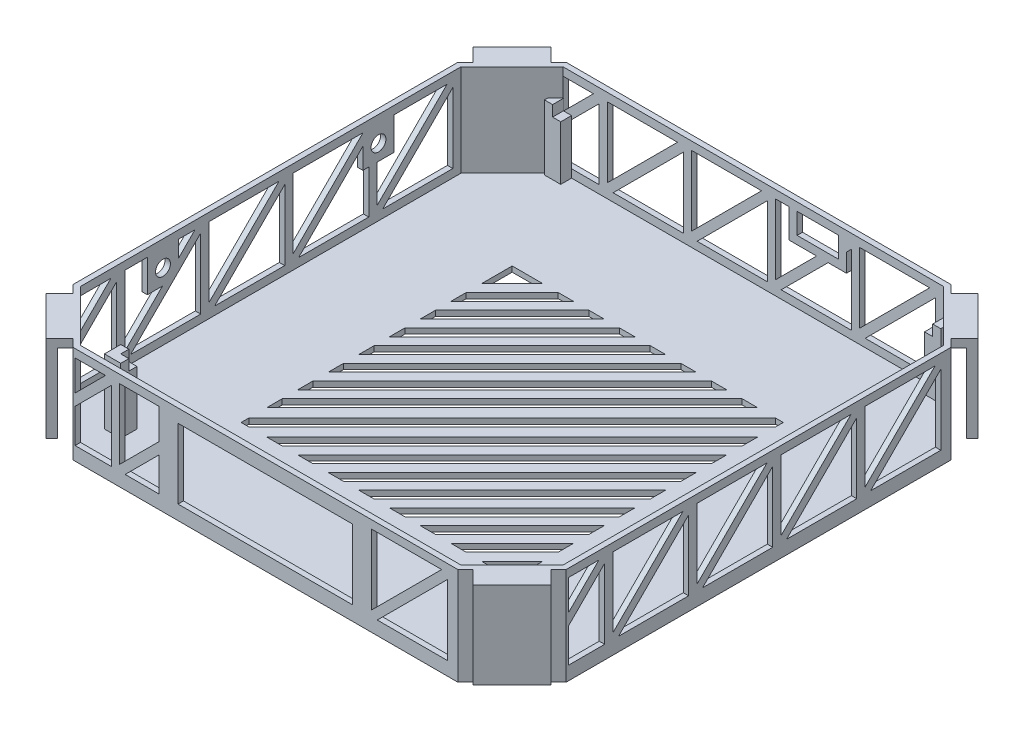
from build123d import *

# Parameters (mm, degrees)
SKETCH1_W              = 20
SKETCH1_H              = 55
SKETCH1_H_2            = 40
SKETCH1_R              = 4.251058991
SKETCH1_H_3            = 7.5
BOSS_EXTRUDE1_DEPTH    = 18
SHELL1_T               = -1
CUT_EXTRUDE1_REACH     = 104.89
BOSS_EXTRUDE3_DEPTH    = 5.07
MIRROR3_COPY_1_DEPTH   = 5.07
CUT_EXTRUDE2_REACH     = 105.845
SKETCH5_R              = 1.375
BOSS_EXTRUDE9_DEPTH    = 12
SKETCH6_6_W            = 1.5
SKETCH6_6_H            = 2
SKETCH6_6_H_2          = 1.5
BOSS_EXTRUDE10_DEPTH   = 10
CUT_EXTRUDE3_REACH     = 105.845
SKETCH7_W              = 32.2
SKETCH7_H              = 12.9
CUT_EXTRUDE7_REACH     = 105.845
BOSS_EXTRUDE12_START   = -45.5
BOSS_EXTRUDE12_DEPTH   = 1
CUT_EXTRUDE8_START     = 12.66
CUT_EXTRUDE8_OUTLINE_W = 3.685786438
CUT_EXTRUDE8_OUTLINE_H = 2.5
CUT_EXTRUDE8_DEPTH     = 2.500660172
CUT_EXTRUDE9_REACH     = 105.845
CUT_EXTRUDE10_REACH    = 70.005
CUT_EXTRUDE11_REACH    = 70.005
LPATTERN1_DEPTH        = 1


# Read off the part's stored shape, not the designer's step: Boss-Extrude12, Cut-Extrude8, LPattern1
with BuildPart() as part:
    # Sketch1 → Boss-Extrude1 (new body)
    # profile 1 of 5: a face of its own
    with BuildSketch(Plane(origin=(0, 0, 0), x_dir=(1, 0, 0), z_dir=(0, 1, 0))):
        Polygon((-45.5, 35.5), (-45.5, -35.5), (-35.5, -45.5), (35.5, -45.5), (45.5, -35.5), (45.5, 35.5), (35.5, 45.5), (-35.5, 45.5), align=None)
        with Locations((0, -10.9)):
            Rectangle(SKETCH1_W, SKETCH1_H, mode=Mode.SUBTRACT)
    # profile 2 of 5: a face of its own
    with BuildSketch(Plane(origin=(0, 0, 0), x_dir=(1, 0, 0), z_dir=(0, 1, 0))):
        with Locations((0, -10.9)):
            Rectangle(SKETCH1_W, SKETCH1_H_2)
        Circle(SKETCH1_R, mode=Mode.SUBTRACT)
    # profile 3 of 5: a face of its own
    with BuildSketch(Plane(origin=(0, 0, 0), x_dir=(1, 0, 0), z_dir=(0, 1, 0))):
        with Locations((0, 12.85)):
            Rectangle(SKETCH1_W, SKETCH1_H_3)
    # profile 4 of 5: a face of its own
    with BuildSketch(Plane(origin=(0, 0, 0), x_dir=(1, 0, 0), z_dir=(0, 1, 0))):
        with Locations((0, -34.65)):
            Rectangle(SKETCH1_W, SKETCH1_H_3)
    # profile 5 of 5: a face of its own
    with BuildSketch(Plane(origin=(0, 0, 0), x_dir=(1, 0, 0), z_dir=(0, 1, 0))):
        Circle(SKETCH1_R)
    extrude(amount=BOSS_EXTRUDE1_DEPTH)

    # Shell1
    shell1_openings = [part.faces().sort_by_distance(p)[0] for p in [
        (0, 18, 0),
    ]]
    offset(amount=SHELL1_T, openings=shell1_openings, kind=Kind.INTERSECTION)

    # Sketch2 → Cut-Extrude1 (cut, up to next)
    with BuildSketch(Plane(origin=(44.5, 0, 1), x_dir=(0, 0, -1), z_dir=(1, 0, 0)), mode=Mode.PRIVATE) as cut_extrude1_sk1:
        Polygon((34.585786438, 15.439339828), (21.646446609, 2.5), (34.585786438, 2.5), align=None)
    cut_extrude1_tool1 = extrude(cut_extrude1_sk1.sketch, amount=CUT_EXTRUDE1_REACH, mode=Mode.PRIVATE) & part.part
    # Sketch2 → Cut-Extrude1 (cut, up to next)
    with BuildSketch(Plane(origin=(44.5, 0, 1), x_dir=(0, 0, -1), z_dir=(1, 0, 0)), mode=Mode.PRIVATE) as cut_extrude1_sk2:
        Polygon((33.525126266, 16.5), (20.585786438, 16.5), (20.585786438, 3.560660172), align=None)
    cut_extrude1_tool2 = extrude(cut_extrude1_sk2.sketch, amount=CUT_EXTRUDE1_REACH, mode=Mode.PRIVATE) & part.part
    # Sketch2 → Cut-Extrude1 (cut, up to next)
    with BuildSketch(Plane(origin=(44.5, 0, 1), x_dir=(0, 0, -1), z_dir=(1, 0, 0)), mode=Mode.PRIVATE) as cut_extrude1_sk3:
        Polygon((6.146446609, 2.5), (19.085786438, 2.5), (19.085786438, 15.439339828), align=None)
    cut_extrude1_tool3 = extrude(cut_extrude1_sk3.sketch, amount=CUT_EXTRUDE1_REACH, mode=Mode.PRIVATE) & part.part
    # Sketch2 → Cut-Extrude1 (cut, up to next)
    with BuildSketch(Plane(origin=(44.5, 0, 1), x_dir=(0, 0, -1), z_dir=(1, 0, 0)), mode=Mode.PRIVATE) as cut_extrude1_sk4:
        Polygon((18.025126266, 16.5), (5.085786438, 16.5), (5.085786438, 3.560660172), align=None)
    cut_extrude1_tool4 = extrude(cut_extrude1_sk4.sketch, amount=CUT_EXTRUDE1_REACH, mode=Mode.PRIVATE) & part.part
    # Sketch2 → Cut-Extrude1 (cut, up to next)
    with BuildSketch(Plane(origin=(44.5, 0, 1), x_dir=(0, 0, -1), z_dir=(1, 0, 0)), mode=Mode.PRIVATE) as cut_extrude1_sk5:
        Polygon((-9.353553391, 2.5), (3.585786438, 2.5), (3.585786438, 15.439339828), align=None)
    cut_extrude1_tool5 = extrude(cut_extrude1_sk5.sketch, amount=CUT_EXTRUDE1_REACH, mode=Mode.PRIVATE) & part.part
    # Sketch2 → Cut-Extrude1 (cut, up to next)
    with BuildSketch(Plane(origin=(44.5, 0, 1), x_dir=(0, 0, -1), z_dir=(1, 0, 0)), mode=Mode.PRIVATE) as cut_extrude1_sk6:
        Polygon((2.525126266, 16.5), (-10.414213562, 16.5), (-10.414213562, 3.560660172), align=None)
    cut_extrude1_tool6 = extrude(cut_extrude1_sk6.sketch, amount=CUT_EXTRUDE1_REACH, mode=Mode.PRIVATE) & part.part
    # Sketch2 → Cut-Extrude1 (cut, up to next)
    with BuildSketch(Plane(origin=(44.5, 0, 1), x_dir=(0, 0, -1), z_dir=(1, 0, 0)), mode=Mode.PRIVATE) as cut_extrude1_sk7:
        Polygon((-12.974873734, 16.5), (-25.914213562, 16.5), (-25.914213562, 3.560660172), align=None)
    cut_extrude1_tool7 = extrude(cut_extrude1_sk7.sketch, amount=CUT_EXTRUDE1_REACH, mode=Mode.PRIVATE) & part.part
    # Sketch2 → Cut-Extrude1 (cut, up to next)
    with BuildSketch(Plane(origin=(44.5, 0, 1), x_dir=(0, 0, -1), z_dir=(1, 0, 0)), mode=Mode.PRIVATE) as cut_extrude1_sk8:
        Polygon((-34.085786438, 8.767766953), (-34.085786438, 2.5), (-27.414213562, 2.5), (-27.414213562, 15.439339828), align=None)
    cut_extrude1_tool8 = extrude(cut_extrude1_sk8.sketch, amount=CUT_EXTRUDE1_REACH, mode=Mode.PRIVATE) & part.part
    # Sketch2 → Cut-Extrude1 (cut, up to next)
    with BuildSketch(Plane(origin=(44.5, 0, 1), x_dir=(0, 0, -1), z_dir=(1, 0, 0)), mode=Mode.PRIVATE) as cut_extrude1_sk9:
        Polygon((-34.085786438, 16.5), (-34.085786438, 10.889087297), (-28.474873734, 16.5), align=None)
    cut_extrude1_tool9 = extrude(cut_extrude1_sk9.sketch, amount=CUT_EXTRUDE1_REACH, mode=Mode.PRIVATE) & part.part
    # Sketch2 → Cut-Extrude1 (cut, up to next)
    with BuildSketch(Plane(origin=(44.5, 0, 1), x_dir=(0, 0, -1), z_dir=(1, 0, 0)), mode=Mode.PRIVATE) as cut_extrude1_sk10:
        Polygon((-11.914213562, 15.439339828), (-24.853553391, 2.5), (-11.914213562, 2.5), align=None)
    cut_extrude1_tool10 = extrude(cut_extrude1_sk10.sketch, amount=CUT_EXTRUDE1_REACH, mode=Mode.PRIVATE) & part.part
    cut_extrude1_1 = cut_extrude1_tool1.solids().sort_by_distance((44.5, 6.813113, -29.272673))[0]
    add(cut_extrude1_1, mode=Mode.SUBTRACT)
    cut_extrude1_2 = cut_extrude1_tool2.solids().sort_by_distance((44.5, 12.186887, -23.8989))[0]
    add(cut_extrude1_2, mode=Mode.SUBTRACT)
    cut_extrude1_3 = cut_extrude1_tool3.solids().sort_by_distance((44.5, 6.813113, -13.772673))[0]
    add(cut_extrude1_3, mode=Mode.SUBTRACT)
    cut_extrude1_4 = cut_extrude1_tool4.solids().sort_by_distance((44.5, 12.186887, -8.3989))[0]
    add(cut_extrude1_4, mode=Mode.SUBTRACT)
    cut_extrude1_5 = cut_extrude1_tool5.solids().sort_by_distance((44.5, 6.813113, 1.727327))[0]
    add(cut_extrude1_5, mode=Mode.SUBTRACT)
    cut_extrude1_6 = cut_extrude1_tool6.solids().sort_by_distance((44.5, 12.186887, 7.1011))[0]
    add(cut_extrude1_6, mode=Mode.SUBTRACT)
    cut_extrude1_7 = cut_extrude1_tool7.solids().sort_by_distance((44.5, 12.186887, 22.6011))[0]
    add(cut_extrude1_7, mode=Mode.SUBTRACT)
    cut_extrude1_8 = cut_extrude1_tool8.solids().sort_by_distance((44.5, 7.49489, 31.363772))[0]
    add(cut_extrude1_8, mode=Mode.SUBTRACT)
    cut_extrude1_9 = cut_extrude1_tool9.solids().sort_by_distance((44.5, 14.629696, 33.215482))[0]
    add(cut_extrude1_9, mode=Mode.SUBTRACT)
    cut_extrude1_10 = cut_extrude1_tool10.solids().sort_by_distance((44.5, 6.813113, 17.227327))[0]
    add(cut_extrude1_10, mode=Mode.SUBTRACT)
    cut_extrude1 = cut_extrude1_1 + cut_extrude1_2 + cut_extrude1_3 + cut_extrude1_4 + cut_extrude1_5 + cut_extrude1_6 + cut_extrude1_7 + cut_extrude1_8 + cut_extrude1_9 + cut_extrude1_10  # Cut-Extrude1 as one shape, for the pattern or mirror that repeats it

    # Sketch4 → Boss-Extrude3 (add, symmetric)
    with BuildSketch(Plane(origin=(0, 0, 0), x_dir=(0.7071067811865482, 0, -0.7071067811865468), z_dir=(0.7071067811865468, 0, 0.7071067811865482))):
        Polygon((57.275649276, 18), (60.775649276, 18), (60.775649276, 2), (59.275649276, 2), (59.275649276, 16.5), (57.275649276, 16.5), align=None)
    boss_extrude3 = extrude(amount=BOSS_EXTRUDE3_DEPTH, both=True)

    # Mirror2: Boss-Extrude3 across plane
    add(boss_extrude3.mirror(Plane(origin=(0, 0, 0), x_dir=(0, 0, 1), z_dir=(1, 0, 0))))

    # Mirror3: Boss-Extrude3 across plane
    add(boss_extrude3.mirror(Plane(origin=(0, 0, 0), x_dir=(1, 0, 0), z_dir=(0, 0, -1))))

    # Mirror3 copy 1 sketch → Mirror3 copy 1 (add, symmetric)
    with BuildSketch(Plane(origin=(0, 0, 0), x_dir=(-0.7071067811865482, 0, 0.7071067811865468), z_dir=(-0.7071067811865468, 0, -0.7071067811865482))):
        Polygon((57.275649276, 18), (60.775649276, 18), (60.775649276, 2), (59.275649276, 2), (59.275649276, 16.5), (57.275649276, 16.5), align=None)
    extrude(amount=MIRROR3_COPY_1_DEPTH, both=True)

    # Sketch5 → Cut-Extrude2 (cut, up to next)
    with BuildSketch(Plane(origin=(-44.5, 0, 0), x_dir=(0, 0, -1), z_dir=(1, 0, 0)), mode=Mode.PRIVATE) as cut_extrude2_sk1:
        with Locations((-19.875, 13.375)):
            Circle(SKETCH5_R)
    cut_extrude2_tool1 = extrude(cut_extrude2_sk1.sketch, amount=-CUT_EXTRUDE2_REACH, mode=Mode.PRIVATE) & part.part
    # Sketch5 → Cut-Extrude2 (cut, up to next)
    with BuildSketch(Plane(origin=(-44.5, 0, 0), x_dir=(0, 0, -1), z_dir=(1, 0, 0)), mode=Mode.PRIVATE) as cut_extrude2_sk2:
        with Locations((19.875, 13.375)):
            Circle(SKETCH5_R)
    cut_extrude2_tool2 = extrude(cut_extrude2_sk2.sketch, amount=-CUT_EXTRUDE2_REACH, mode=Mode.PRIVATE) & part.part
    add(cut_extrude2_tool1.solids().sort_by_distance((-44.5, 13.375, 19.875))[0], mode=Mode.SUBTRACT)
    add(cut_extrude2_tool2.solids().sort_by_distance((-44.5, 13.375, -19.875))[0], mode=Mode.SUBTRACT)

    # Sketch6 → Boss-Extrude9 (add)
    with BuildSketch(Plane(origin=(0, 1, 0), x_dir=(1, 0, 0), z_dir=(0, 1, 0))):
        Polygon((-35.014213562, 42.5), (-35.014213562, 44.5), (-35.085786438, 44.5), (-36.514213562, 43.071572875), (-36.514213562, 42.5), align=None)
        Polygon((36.585786438, 43), (35.085786438, 44.5), (35.085786438, 42.5), (36.585786438, 42.5), align=None)
        Polygon((35.085786438, -37.15), (35.085786438, -35.65), (36.585786438, -35.65), (36.585786438, -38.65), (33.585786438, -38.65), (33.585786438, -37.15), align=None)
        Polygon((-33.514213562, -38.65), (-33.514213562, -37.15), (-35.014213562, -37.15), (-35.014213562, -35.65), (-36.514213562, -35.65), (-36.514213562, -38.65), align=None)
    extrude(amount=BOSS_EXTRUDE9_DEPTH)

    # Sketch6<6> → Boss-Extrude10 (add)
    with BuildSketch(Plane(origin=(0, 1, 0), x_dir=(1, 0, 0), z_dir=(0, 1, 0))):
        with Locations((-34.264213562, 43.5)):
            Rectangle(SKETCH6_6_W, SKETCH6_6_H)
        with Locations((34.335786438, 43.5)):
            Rectangle(SKETCH6_6_W, SKETCH6_6_H)
        with Locations((34.335786438, -36.4)):
            Rectangle(SKETCH6_6_W, SKETCH6_6_H_2)
        with Locations((-34.264213562, -36.4)):
            Rectangle(SKETCH6_6_W, SKETCH6_6_H_2)
    extrude(amount=BOSS_EXTRUDE10_DEPTH)

    # Sketch7 → Cut-Extrude3 (cut, up to next)
    with BuildSketch(Plane(origin=(0, 0, 44.5), x_dir=(-1, 0, 0), z_dir=(0, 0, -1)), mode=Mode.PRIVATE) as cut_extrude3_sk1:
        with Locations((0, 9.1)):
            Rectangle(SKETCH7_W, SKETCH7_H)
    cut_extrude3_tool1 = extrude(cut_extrude3_sk1.sketch, amount=-CUT_EXTRUDE3_REACH, mode=Mode.PRIVATE) & part.part
    add(cut_extrude3_tool1.solids().sort_by_distance((0, 9.1, 44.5))[0], mode=Mode.SUBTRACT)

    # Sketch10 → Cut-Extrude7 (cut, up to next)
    with BuildSketch(Plane(origin=(-44.5, 0, 0), x_dir=(0, 0, -1), z_dir=(1, 0, 0)), mode=Mode.PRIVATE) as cut_extrude7_sk1:
        Polygon((2.585786438, 2.5), (2.585786438, 15.439339828), (-10.353553391, 2.5), align=None)
    cut_extrude7_tool1 = extrude(cut_extrude7_sk1.sketch, amount=-CUT_EXTRUDE7_REACH, mode=Mode.PRIVATE) & part.part
    # Sketch10 → Cut-Extrude7 (cut, up to next)
    with BuildSketch(Plane(origin=(-44.5, 0, 0), x_dir=(0, 0, -1), z_dir=(1, 0, 0)), mode=Mode.PRIVATE) as cut_extrude7_sk2:
        Polygon((-11.414213562, 3.560660172), (1.525126266, 16.5), (-11.414213562, 16.5), align=None)
    cut_extrude7_tool2 = extrude(cut_extrude7_sk2.sketch, amount=-CUT_EXTRUDE7_REACH, mode=Mode.PRIVATE) & part.part
    # Sketch10 → Cut-Extrude7 (cut, up to next)
    with BuildSketch(Plane(origin=(-44.5, 0, 0), x_dir=(0, 0, -1), z_dir=(1, 0, 0)), mode=Mode.PRIVATE) as cut_extrude7_sk3:
        Polygon((17, 10.5), (17, 14.353553391), (5.146446609, 2.5), (18.085786438, 2.5), (18.085786438, 10.5), align=None)
    cut_extrude7_tool3 = extrude(cut_extrude7_sk3.sketch, amount=-CUT_EXTRUDE7_REACH, mode=Mode.PRIVATE) & part.part
    # Sketch10 → Cut-Extrude7 (cut, up to next)
    with BuildSketch(Plane(origin=(-44.5, 0, 0), x_dir=(0, 0, -1), z_dir=(1, 0, 0)), mode=Mode.PRIVATE) as cut_extrude7_sk4:
        Polygon((4.085786438, 3.560660172), (17, 16.474873734), (17, 16.5), (4.085786438, 16.5), align=None)
    cut_extrude7_tool4 = extrude(cut_extrude7_sk4.sketch, amount=-CUT_EXTRUDE7_REACH, mode=Mode.PRIVATE) & part.part
    # Sketch10 → Cut-Extrude7 (cut, up to next)
    with BuildSketch(Plane(origin=(-44.5, 0, 0), x_dir=(0, 0, -1), z_dir=(1, 0, 0)), mode=Mode.PRIVATE) as cut_extrude7_sk5:
        Polygon((22.75, 10.5), (19.585786438, 10.5), (19.585786438, 3.560660172), (32.525126266, 16.5), (22.75, 16.5), align=None)
    cut_extrude7_tool5 = extrude(cut_extrude7_sk5.sketch, amount=-CUT_EXTRUDE7_REACH, mode=Mode.PRIVATE) & part.part
    # Sketch10 → Cut-Extrude7 (cut, up to next)
    with BuildSketch(Plane(origin=(-44.5, 0, 0), x_dir=(0, 0, -1), z_dir=(1, 0, 0)), mode=Mode.PRIVATE) as cut_extrude7_sk6:
        Polygon((33.585786438, 15.439339828), (20.646446609, 2.5), (33.585786438, 2.5), align=None)
    cut_extrude7_tool6 = extrude(cut_extrude7_sk6.sketch, amount=-CUT_EXTRUDE7_REACH, mode=Mode.PRIVATE) & part.part
    # Sketch10 → Cut-Extrude7 (cut, up to next)
    with BuildSketch(Plane(origin=(-44.5, 0, 0), x_dir=(0, 0, -1), z_dir=(1, 0, 0)), mode=Mode.PRIVATE) as cut_extrude7_sk7:
        Polygon((-25.853553391, 2.5), (-12.914213562, 2.5), (-12.914213562, 15.439339828), align=None)
    cut_extrude7_tool7 = extrude(cut_extrude7_sk7.sketch, amount=-CUT_EXTRUDE7_REACH, mode=Mode.PRIVATE) & part.part
    # Sketch10 → Cut-Extrude7 (cut, up to next)
    with BuildSketch(Plane(origin=(-44.5, 0, 0), x_dir=(0, 0, -1), z_dir=(1, 0, 0)), mode=Mode.PRIVATE) as cut_extrude7_sk8:
        Polygon((-17, 16.5), (-17, 13.474873734), (-13.974873734, 16.5), align=None)
    cut_extrude7_tool8 = extrude(cut_extrude7_sk8.sketch, amount=-CUT_EXTRUDE7_REACH, mode=Mode.PRIVATE) & part.part
    # Sketch10 → Cut-Extrude7 (cut, up to next)
    with BuildSketch(Plane(origin=(-44.5, 0, 0), x_dir=(0, 0, -1), z_dir=(1, 0, 0)), mode=Mode.PRIVATE) as cut_extrude7_sk9:
        Polygon((-26.914213562, 3.560660172), (-19.974873734, 10.5), (-22.75, 10.5), (-22.75, 16.5), (-26.914213562, 16.5), align=None)
    cut_extrude7_tool9 = extrude(cut_extrude7_sk9.sketch, amount=-CUT_EXTRUDE7_REACH, mode=Mode.PRIVATE) & part.part
    # Sketch10 → Cut-Extrude7 (cut, up to next)
    with BuildSketch(Plane(origin=(-44.5, 0, 0), x_dir=(0, 0, -1), z_dir=(1, 0, 0)), mode=Mode.PRIVATE) as cut_extrude7_sk10:
        Polygon((-28.414213562, 2.5), (-28.414213562, 15.439339828), (-35.085786438, 8.767766953), (-35.085786438, 2.5), align=None)
    cut_extrude7_tool10 = extrude(cut_extrude7_sk10.sketch, amount=-CUT_EXTRUDE7_REACH, mode=Mode.PRIVATE) & part.part
    # Sketch10 → Cut-Extrude7 (cut, up to next)
    with BuildSketch(Plane(origin=(-44.5, 0, 0), x_dir=(0, 0, -1), z_dir=(1, 0, 0)), mode=Mode.PRIVATE) as cut_extrude7_sk11:
        Polygon((-35.085786438, 16.5), (-35.085786438, 10.889087297), (-29.474873734, 16.5), align=None)
    cut_extrude7_tool11 = extrude(cut_extrude7_sk11.sketch, amount=-CUT_EXTRUDE7_REACH, mode=Mode.PRIVATE) & part.part
    add(cut_extrude7_tool1.solids().sort_by_distance((-44.5, 6.813113, 1.727327))[0], mode=Mode.SUBTRACT)
    add(cut_extrude7_tool2.solids().sort_by_distance((-44.5, 12.186887, 7.1011))[0], mode=Mode.SUBTRACT)
    add(cut_extrude7_tool3.solids().sort_by_distance((-44.5, 6.456556, -13.543331))[0], mode=Mode.SUBTRACT)
    add(cut_extrude7_tool4.solids().sort_by_distance((-44.5, 12.18687, -8.398867))[0], mode=Mode.SUBTRACT)
    add(cut_extrude7_tool5.solids().sort_by_distance((-44.5, 11.801739, -24.699928))[0], mode=Mode.SUBTRACT)
    add(cut_extrude7_tool6.solids().sort_by_distance((-44.5, 6.813113, -29.272673))[0], mode=Mode.SUBTRACT)
    add(cut_extrude7_tool7.solids().sort_by_distance((-44.5, 6.813113, 17.227327))[0], mode=Mode.SUBTRACT)
    add(cut_extrude7_tool8.solids().sort_by_distance((-44.5, 15.491625, 15.991625))[0], mode=Mode.SUBTRACT)
    add(cut_extrude7_tool9.solids().sort_by_distance((-44.5, 10.892612, 24.718741))[0], mode=Mode.SUBTRACT)
    add(cut_extrude7_tool10.solids().sort_by_distance((-44.5, 7.49489, 31.363772))[0], mode=Mode.SUBTRACT)
    add(cut_extrude7_tool11.solids().sort_by_distance((-44.5, 14.629696, 33.215482))[0], mode=Mode.SUBTRACT)

    # Mirror4: Cut-Extrude1 across plane
    add(cut_extrude1.mirror(Plane(origin=(0, 0, 0), x_dir=(-0.7071067811865482, 0, 0.7071067811865468), z_dir=(0.7071067811865468, 0, 0.7071067811865482))), mode=Mode.SUBTRACT)

    # Boss-Extrude12 outline → Boss-Extrude12 (add)
    with BuildSketch(Plane.XY.offset(BOSS_EXTRUDE12_START)):
        Polygon((17.185786438, 14.539339828), (15.685786438, 13.039339828), (15.685786438, 12.66), (15.306446609, 12.66), (13.806446609, 11.16), (17.185786438, 11.16), align=None)
        Polygon((17.025126266, 16.5), (15.685786438, 16.5), (15.685786438, 15.160660172), align=None)
        Polygon((8.085786438, 12.66), (8.085786438, 16.5), (6.585786438, 16.5), (6.585786438, 11.16), (11.685126266, 11.16), (13.185126266, 12.66), align=None)
    extrude(amount=BOSS_EXTRUDE12_DEPTH)

    # Cut-Extrude8 outline → Cut-Extrude8 (cut)
    with BuildSketch(Plane(origin=(0, 0, 0), x_dir=(1, 0, 0), z_dir=(0, 1, 0)).offset(CUT_EXTRUDE8_START)):
        with Locations((13.842893219, 45.75)):
            Rectangle(CUT_EXTRUDE8_OUTLINE_W, CUT_EXTRUDE8_OUTLINE_H)
    extrude(amount=CUT_EXTRUDE8_DEPTH, mode=Mode.SUBTRACT)

    # Sketch11 → Cut-Extrude9 (cut, up to next)
    with BuildSketch(Plane(origin=(0, 0, 44.5), x_dir=(-1, 0, 0), z_dir=(0, 0, -1)), mode=Mode.PRIVATE) as cut_extrude9_sk1:
        Polygon((-33.585786438, 2.5), (-20.646446609, 2.5), (-33.585786438, 15.439339828), align=None)
    cut_extrude9_tool1 = extrude(cut_extrude9_sk1.sketch, amount=-CUT_EXTRUDE9_REACH, mode=Mode.PRIVATE) & part.part
    # Sketch11 → Cut-Extrude9 (cut, up to next)
    with BuildSketch(Plane(origin=(0, 0, 44.5), x_dir=(-1, 0, 0), z_dir=(0, 0, -1)), mode=Mode.PRIVATE) as cut_extrude9_sk2:
        Polygon((-19.585786438, 3.560660172), (-32.525126266, 16.5), (-19.585786438, 16.5), align=None)
    cut_extrude9_tool2 = extrude(cut_extrude9_sk2.sketch, amount=-CUT_EXTRUDE9_REACH, mode=Mode.PRIVATE) & part.part
    # Sketch11 → Cut-Extrude9 (cut, up to next)
    with BuildSketch(Plane(origin=(0, 0, 44.5), x_dir=(-1, 0, 0), z_dir=(0, 0, -1)), mode=Mode.PRIVATE) as cut_extrude9_sk3:
        Polygon((26.914213562, 16.5), (19.59, 16.5), (19.59, 10.884873734), (26.914213562, 3.560660172), align=None)
    cut_extrude9_tool3 = extrude(cut_extrude9_sk3.sketch, amount=-CUT_EXTRUDE9_REACH, mode=Mode.PRIVATE) & part.part
    # Sketch11 → Cut-Extrude9 (cut, up to next)
    with BuildSketch(Plane(origin=(0, 0, 44.5), x_dir=(-1, 0, 0), z_dir=(0, 0, -1)), mode=Mode.PRIVATE) as cut_extrude9_sk4:
        Polygon((25.853553391, 2.5), (19.59, 8.763553391), (19.59, 2.5), align=None)
    cut_extrude9_tool4 = extrude(cut_extrude9_sk4.sketch, amount=-CUT_EXTRUDE9_REACH, mode=Mode.PRIVATE) & part.part
    # Sketch11 → Cut-Extrude9 (cut, up to next)
    with BuildSketch(Plane(origin=(0, 0, 44.5), x_dir=(-1, 0, 0), z_dir=(0, 0, -1)), mode=Mode.PRIVATE) as cut_extrude9_sk5:
        Polygon((28.414213562, 15.439339828), (28.414213562, 2.5), (35.085786438, 2.5), (35.085786438, 8.767766953), align=None)
    cut_extrude9_tool5 = extrude(cut_extrude9_sk5.sketch, amount=-CUT_EXTRUDE9_REACH, mode=Mode.PRIVATE) & part.part
    # Sketch11 → Cut-Extrude9 (cut, up to next)
    with BuildSketch(Plane(origin=(0, 0, 44.5), x_dir=(-1, 0, 0), z_dir=(0, 0, -1)), mode=Mode.PRIVATE) as cut_extrude9_sk6:
        Polygon((29.474873734, 16.5), (35.085786438, 10.889087297), (35.085786438, 16.5), align=None)
    cut_extrude9_tool6 = extrude(cut_extrude9_sk6.sketch, amount=-CUT_EXTRUDE9_REACH, mode=Mode.PRIVATE) & part.part
    add(cut_extrude9_tool1.solids().sort_by_distance((29.272673, 6.813113, 44.5))[0], mode=Mode.SUBTRACT)
    add(cut_extrude9_tool2.solids().sort_by_distance((23.8989, 12.186887, 44.5))[0], mode=Mode.SUBTRACT)
    add(cut_extrude9_tool3.solids().sort_by_distance((-23.733968, 11.620453, 44.5))[0], mode=Mode.SUBTRACT)
    add(cut_extrude9_tool4.solids().sort_by_distance((-21.677851, 4.587851, 44.5))[0], mode=Mode.SUBTRACT)
    add(cut_extrude9_tool5.solids().sort_by_distance((-31.363772, 7.49489, 44.5))[0], mode=Mode.SUBTRACT)
    add(cut_extrude9_tool6.solids().sort_by_distance((-33.215482, 14.629696, 44.5))[0], mode=Mode.SUBTRACT)

    # Sketch12 → Cut-Extrude10 (cut, up to next)
    with BuildSketch(Plane(origin=(0, 1, 0), x_dir=(1, 0, 0), z_dir=(0, 1, 0)), mode=Mode.PRIVATE) as cut_extrude10_sk1:
        Polygon((-24.964213562, 25), (-24.964213562, 19.343145751), (-19.307359313, 25), align=None)
    cut_extrude10_tool1 = extrude(cut_extrude10_sk1.sketch, amount=-CUT_EXTRUDE10_REACH, mode=Mode.PRIVATE) & part.part
    # Sketch12 → Cut-Extrude10 (cut, up to next)
    with BuildSketch(Plane(origin=(0, 1, 0), x_dir=(1, 0, 0), z_dir=(0, 1, 0)), mode=Mode.PRIVATE) as cut_extrude10_sk2:
        Polygon((25.035786438, -19.343145751), (25.035786438, -25), (19.378932188, -25), align=None)
    cut_extrude10_tool2 = extrude(cut_extrude10_sk2.sketch, amount=-CUT_EXTRUDE10_REACH, mode=Mode.PRIVATE) & part.part
    # Sketch12 → Cut-Extrude10 (cut, up to next)
    with BuildSketch(Plane(origin=(0, 1, 0), x_dir=(1, 0, 0), z_dir=(0, 1, 0)), mode=Mode.PRIVATE) as cut_extrude10_sk3:
        Polygon((23.621572875, 25), (-24.964213562, -23.585786438), (-24.964213562, -25), (-23.55, -25), (25.035786438, 23.585786438), (25.035786438, 25), align=None)
    cut_extrude10_tool3 = extrude(cut_extrude10_sk3.sketch, amount=-CUT_EXTRUDE10_REACH, mode=Mode.PRIVATE) & part.part
    add(cut_extrude10_tool1.solids().sort_by_distance((-23.078595, 1, -23.114382))[0], mode=Mode.SUBTRACT)
    add(cut_extrude10_tool2.solids().sort_by_distance((23.150168, 1, 23.114382))[0], mode=Mode.SUBTRACT)
    add(cut_extrude10_tool3.solids().sort_by_distance((0.035786, 1, 0))[0], mode=Mode.SUBTRACT)

    # Sketch13 → Cut-Extrude11 (cut, up to next)
    with BuildSketch(Plane(origin=(0, 1, 0), x_dir=(1, 0, 0), z_dir=(0, 1, 0)), mode=Mode.PRIVATE) as cut_extrude11_sk1:
        Polygon((-24.964213562, 16.514718626), (-24.964213562, 13.686291501), (-13.650505063, 25), (-16.478932188, 25), align=None)
    cut_extrude11_tool1 = extrude(cut_extrude11_sk1.sketch, amount=-CUT_EXTRUDE11_REACH, mode=Mode.PRIVATE) & part.part
    cut_extrude11 = cut_extrude11_tool1.solids().sort_by_distance((-19.980794, 1, -20.016581))[0]
    add(cut_extrude11, mode=Mode.SUBTRACT)

    # LPattern1 outline → LPattern1 (cut)
    with BuildSketch(Plane(origin=(0, 0, 0), x_dir=(1, 0, 0), z_dir=(0, 1, 0))):
        Polygon((-10.822077939, 25), (-24.964213562, 10.857864376), (-24.964213562, 8.029437252), (-7.993650814, 25), align=None)
        Polygon((17.462193309, 25), (-24.964213562, -17.426406871), (-24.964213562, -20.254833996), (20.290620434, 25), align=None)
        Polygon((0.49163056, 25), (-24.964213562, -0.455844123), (-24.964213562, -3.284271247), (3.320057685, 25), align=None)
        Polygon((-5.165223689, 25), (-24.964213562, 5.201010127), (-24.964213562, 2.372583002), (-2.336796564, 25), align=None)
        Polygon((11.805339059, 25), (-24.964213562, -11.769552622), (-24.964213562, -14.597979746), (14.633766184, 25), align=None)
        Polygon((6.14848481, 25), (-24.964213562, -6.112698372), (-24.964213562, -8.941125497), (8.976911935, 25), align=None)
    lpattern1 = extrude(amount=LPATTERN1_DEPTH, mode=Mode.SUBTRACT)

    # Mirror5: Cut-Extrude11, LPattern1 across plane
    add(cut_extrude11.mirror(Plane(origin=(0, 0, 0), x_dir=(-0.7071067811865482, 0, 0.7071067811865468), z_dir=(0.7071067811865468, 0, 0.7071067811865482))), mode=Mode.SUBTRACT)
    add(lpattern1.mirror(Plane(origin=(0, 0, 0), x_dir=(-0.7071067811865482, 0, 0.7071067811865468), z_dir=(0.7071067811865468, 0, 0.7071067811865482))), mode=Mode.SUBTRACT)


solid = part.part
